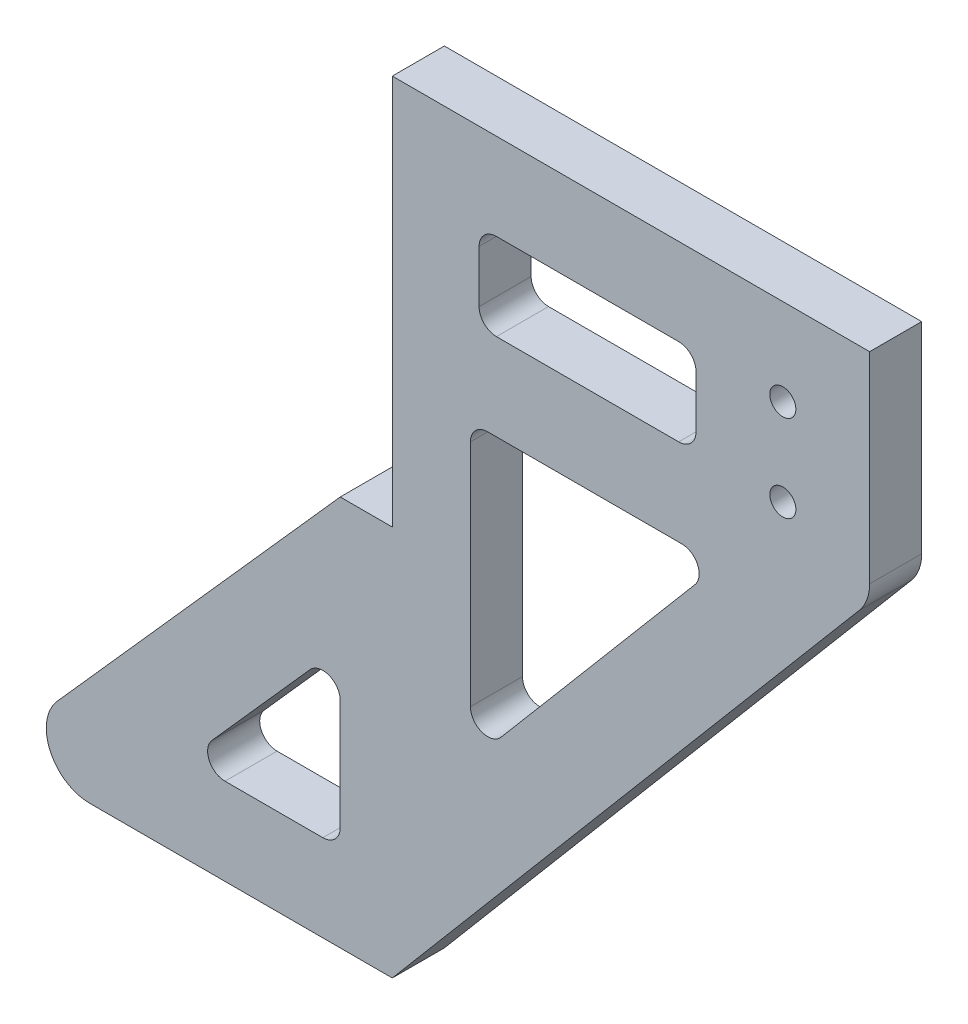
from build123d import *

# Parameters (mm, degrees)
BOSS_EXTRUDE1_DEPTH     = 6
CUT_EXTRUDE2_DEPTH      = 106.645634079
CUT_EXTRUDE2_DEPTH_BACK = 106.645634079
SKETCH4_R               = 1.5
SKETCH4_W               = 25
SKETCH4_H               = 10
FILLET1_R               = 2
FILLET2_R               = 2
FILLET3_R               = 5


with BuildPart() as part:
    # Sketch1 → Boss-Extrude1 (new body)
    with BuildSketch(Plane.XY):
        Polygon((0, 0), (55, 0), (55, -25), (0, -90), (-46, -90), (-6, -45), (0, -45), align=None)
    extrude(amount=BOSS_EXTRUDE1_DEPTH)

    # Sketch4 → Cut-Extrude2 (cut, two sides: drawn at the far end of the back side and taken through both)
    with BuildSketch(Plane.XY.offset(6).offset(-CUT_EXTRUDE2_DEPTH_BACK)):
        with Locations((45, -20)):
            Circle(SKETCH4_R)
        with Locations((45, -10)):
            Circle(SKETCH4_R)
        Polygon((9, -30), (9, -63.882376031), (37.669702795, -30), align=None)
        Polygon((-6, -60.051993223), (-23.731561579, -80), (-6, -80), align=None)
        with Locations((22.5, -15)):
            Rectangle(SKETCH4_W, SKETCH4_H)
    extrude(amount=CUT_EXTRUDE2_DEPTH + CUT_EXTRUDE2_DEPTH_BACK, mode=Mode.SUBTRACT)

    # Fillet1
    fillet1_edges = [part.edges().sort_by_distance(p)[0] for p in [
        (-23.731561579, -80, 3),
        (-6, -80, 3),
        (-6, -60.051993223, 3),
        (10, -20, 3),
        (35, -20, 3),
        (10, -10, 3),
        (35, -10, 3),
    ]]
    fillet(fillet1_edges, radius=FILLET1_R)

    # Fillet2
    fillet2_edges = [part.edges().sort_by_distance(p)[0] for p in [
        (9, -63.882376031, 3),
        (9, -30, 3),
        (37.669702795, -30, 3),
    ]]
    fillet(fillet2_edges, radius=FILLET2_R)

    # Fillet3
    fillet3_edges = [part.edges().sort_by_distance(p)[0] for p in [
        (55, -25, 3),
        (-46, -90, 3),
    ]]
    fillet(fillet3_edges, radius=FILLET3_R)


solid = part.part
